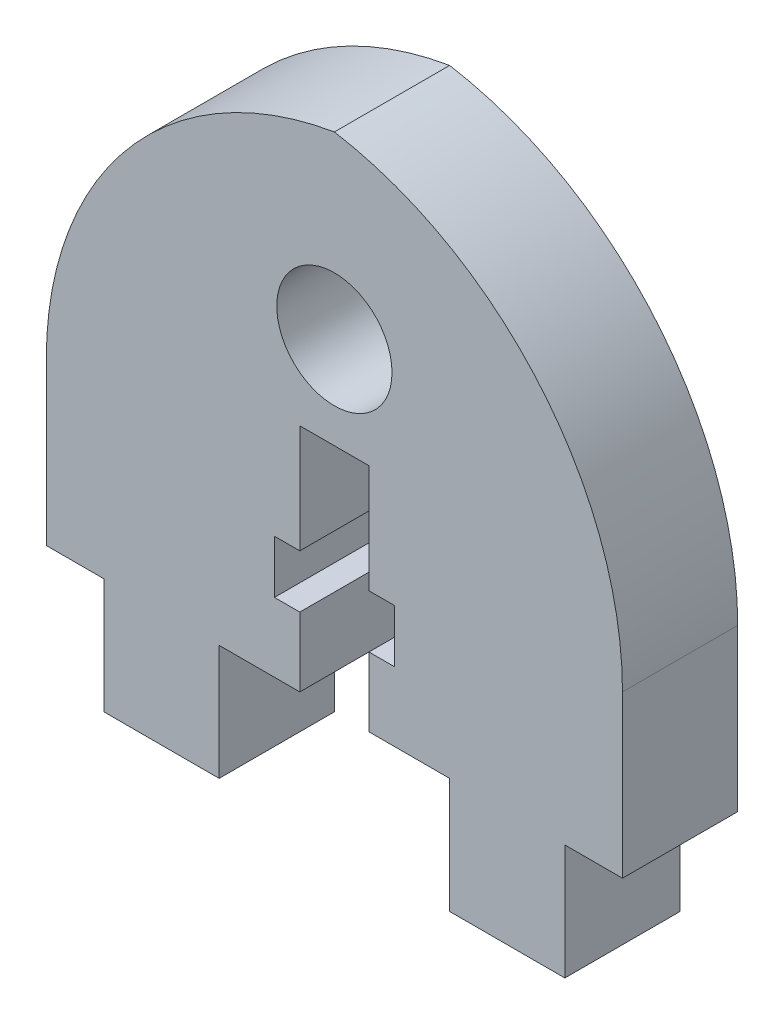
from build123d import *

# Parameters (mm, degrees)
SKETCH1_R           = 2.5
SKETCH1_W           = 5
SKETCH1_H           = 5
BOSS_EXTRUDE1_DEPTH = 5
FILLET1_R           = 15


with BuildPart() as part:
    # Sketch1 → Boss-Extrude1 (new body)
    # profile 1 of 3: a face of its own
    with BuildSketch(Plane.XY):
        Polygon((-12.5, 8), (-12.5, -14), (-10, -14), (-5, -14), (-1.5, -14), (-1.5, -11), (-2.6, -11), (-2.6, -8.7), (-1.5, -8.7), (-1.5, -4), (1.5, -4), (1.5, -8.7), (2.6, -8.7), (2.6, -11), (1.5, -11), (1.5, -14), (5, -14), (10, -14), (12.5, -14), (12.5, 8), align=None)
        Circle(SKETCH1_R, mode=Mode.SUBTRACT)
    # profile 2 of 3: a face of its own
    with BuildSketch(Plane.XY):
        with Locations((-7.5, -16.5)):
            Rectangle(SKETCH1_W, SKETCH1_H)
    # profile 3 of 3: a face of its own
    with BuildSketch(Plane.XY):
        with Locations((7.5, -16.5)):
            Rectangle(SKETCH1_W, SKETCH1_H)
    extrude(amount=BOSS_EXTRUDE1_DEPTH)

    # Fillet1
    # the kernel refuses this fillet: 15 mm, written as the material it takes off along each edge
    with BuildSketch(Plane(origin=(-12.5, 8, -37.5), x_dir=(0, -1, 0), z_dir=(0, 0, 1)), Plane(origin=(12.5, 8, -37.5), x_dir=(-1, 0, 0), z_dir=(0, 0, 1))) as fillet1_piece_1:
        with BuildLine():
            CenterArc((FILLET1_R, FILLET1_R), FILLET1_R, 180, 90)
            Line((0, FILLET1_R), (0, 0))
            Line((0, 0), (FILLET1_R, 0))
        make_face()
    extrude(amount=80, mode=Mode.SUBTRACT)


solid = part.part
